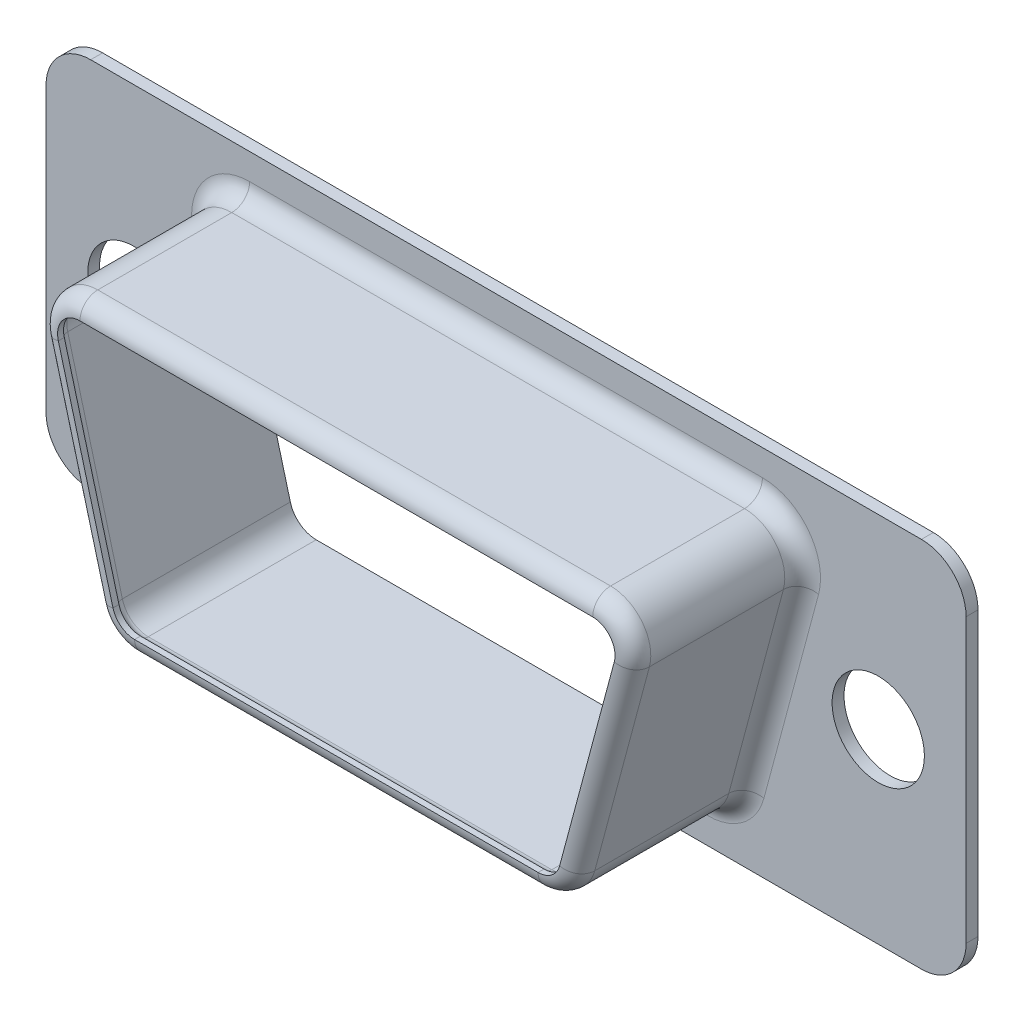
from build123d import *

# Parameters (mm, degrees)
SKETCH1_R           = 1.55
BOSS_EXTRUDE1_DEPTH = 0.4
BOSS_EXTRUDE2_DEPTH = 5.7
FILLET1_R           = 0.6
CUT_EXTRUDE1_DEPTH  = 5.9
FILLET2_R           = 0.3


# Some blends are built 0.0001 mm under size
with BuildPart() as part:
    # Sketch1 → Boss-Extrude1 (new body)
    with BuildSketch(Plane.XY):
        with BuildLine():
            Line((-13.95, 6.25), (13.95, 6.25))
            ThreePointArc((13.95, 6.25), (15.010660172, 5.810660172), (15.45, 4.75))
            Line((15.45, 4.75), (15.45, -4.75))
            ThreePointArc((15.45, -4.75), (15.010660172, -5.810660172), (13.95, -6.25))
            Line((13.95, -6.25), (-13.95, -6.25))
            ThreePointArc((-13.95, -6.25), (-15.010660172, -5.810660172), (-15.45, -4.75))
            Line((-15.45, -4.75), (-15.45, 4.75))
            ThreePointArc((-15.45, 4.75), (-15.010660172, 5.810660172), (-13.95, 6.25))
        make_face()
        with Locations((-12.5, 0)):
            Circle(SKETCH1_R, mode=Mode.SUBTRACT)
        with Locations((12.5, 0)):
            Circle(SKETCH1_R, mode=Mode.SUBTRACT)
        with BuildLine():
            Line((-8.611007598, 4.175), (8.611007598, 4.175))
            ThreePointArc((8.611007598, 4.175), (9.206022604, 3.881571072), (9.335451968, 3.230885716))
            Line((9.335451968, 3.230885716), (7.5, -3.619114284))
            ThreePointArc((7.5, -3.619114284), (7.232126702, -4.020015005), (6.77555563, -4.175))
            Line((6.77555563, -4.175), (-6.77555563, -4.175))
            ThreePointArc((-6.77555563, -4.175), (-7.232126702, -4.020015005), (-7.5, -3.619114284))
            Line((-7.5, -3.619114284), (-9.335451968, 3.230885716))
            ThreePointArc((-9.335451968, 3.230885716), (-9.206022604, 3.881571072), (-8.611007598, 4.175))
        make_face(mode=Mode.SUBTRACT)
    extrude(amount=BOSS_EXTRUDE1_DEPTH)

    # Sketch2 → Boss-Extrude2 (add)
    with BuildSketch(Plane.XY.offset(0.4)):
        with BuildLine():
            Line((-6.77555563, -4.775), (6.77555563, -4.775))
            ThreePointArc((6.77555563, -4.775), (7.597383559, -4.496027009), (8.079555496, -3.774405711))
            Line((8.079555496, -3.774405711), (9.915007464, 3.075594289))
            ThreePointArc((9.915007464, 3.075594289), (9.682034608, 4.246827929), (8.611007598, 4.775))
            Line((8.611007598, 4.775), (-8.611007598, 4.775))
            ThreePointArc((-8.611007598, 4.775), (-9.682034608, 4.246827929), (-9.915007464, 3.075594289))
            Line((-9.915007464, 3.075594289), (-8.079555496, -3.774405711))
            ThreePointArc((-8.079555496, -3.774405711), (-7.597383559, -4.496027009), (-6.77555563, -4.775))
        make_face()
        with BuildLine():
            Line((-6.77555563, -4.175), (6.77555563, -4.175))
            ThreePointArc((6.77555563, -4.175), (7.232126702, -4.020015005), (7.5, -3.619114284))
            Line((7.5, -3.619114284), (9.335451968, 3.230885716))
            ThreePointArc((9.335451968, 3.230885716), (9.206022604, 3.881571072), (8.611007598, 4.175))
            Line((8.611007598, 4.175), (-8.611007598, 4.175))
            ThreePointArc((-8.611007598, 4.175), (-9.206022604, 3.881571072), (-9.335451968, 3.230885716))
            Line((-9.335451968, 3.230885716), (-7.5, -3.619114284))
            ThreePointArc((-7.5, -3.619114284), (-7.232126702, -4.020015005), (-6.77555563, -4.175))
        make_face(mode=Mode.SUBTRACT)
    extrude(amount=BOSS_EXTRUDE2_DEPTH)

    # Fillet1
    fillet1_edges = [part.edges().sort_by_distance(p)[0] for p in [
        (-7.597383559, -4.496027009, 6.1),
        (0, -4.775, 6.1),
        (7.597383559, -4.496027009, 6.1),
        (8.99728148, -0.349405711, 6.1),
        (9.682034608, 4.246827929, 6.1),
        (0, 4.775, 6.1),
        (-9.682034608, 4.246827929, 6.1),
        (-8.99728148, -0.349405711, 6.1),
        (-7.597383559, -4.496027009, 0.4),
        (0, -4.775, 0.4),
        (7.597383559, -4.496027009, 0.4),
        (8.99728148, -0.349405711, 0.4),
        (9.682034608, 4.246827929, 0.4),
        (0, 4.775, 0.4),
        (-9.682034608, 4.246827929, 0.4),
        (-8.99728148, -0.349405711, 0.4),
    ]]
    fillet(fillet1_edges, radius=FILLET1_R - 0.0001)  # a hair under: the kernel refuses the full size

    # Sketch3 → Cut-Extrude1 (cut)
    with BuildSketch(Plane(origin=(0, 0, 0), x_dir=(-1, 0, 0), z_dir=(0, 0, -1))):
        with BuildLine():
            Line((-6.77555563, -4.325), (6.77555563, -4.325))
            ThreePointArc((6.77555563, -4.325), (7.323440916, -4.139018006), (7.644888874, -3.657937141))
            Line((7.644888874, -3.657937141), (9.480340842, 3.192062859))
            ThreePointArc((9.480340842, 3.192062859), (9.325025605, 3.972885286), (8.611007598, 4.325))
            Line((8.611007598, 4.325), (-8.611007598, 4.325))
            ThreePointArc((-8.611007598, 4.325), (-9.325025605, 3.972885286), (-9.480340842, 3.192062859))
            Line((-9.480340842, 3.192062859), (-7.644888874, -3.657937141))
            ThreePointArc((-7.644888874, -3.657937141), (-7.323440916, -4.139018006), (-6.77555563, -4.325))
        make_face()
    extrude(amount=-CUT_EXTRUDE1_DEPTH, mode=Mode.SUBTRACT)

    # Fillet2
    # the kernel refuses this fillet: 0.3 mm, written as the material it adds along each edge
    with BuildSketch(Plane(origin=(6.77555563, -3.425, 5.9), x_dir=(0.9659258262890676, -0.2588190451025228, 0), z_dir=(0.2588190451025228, 0.9659258262890676, 0))) as fillet2_piece_1:
        with BuildLine():
            CenterArc((0.6, 0.259807621), FILLET2_R, 300, 60)
            Line((0.75, 0), (0.753, -0.005196152))
            ThreePointArc((0.753, -0.005196152), (0.825, -0.006), (0.9, -0.006))
            Line((0.9, -0.006), (0.906, 0))
            Line((0.906, 0), (0.906, 0.259807621))
            Line((0.906, 0.259807621), (0.9, 0.259807621))
        make_face()
    revolve(axis=Axis((6.77555563, -3.425, 5.9), (0, 0, -1)), revolution_arc=75)
    with BuildSketch(Plane(origin=(9.480340842, 3.192062859, 5.9), x_dir=(0, 0, -1), z_dir=(-0.25881904510252507, -0.9659258262890672, 0)), Plane(origin=(-7.644888874, -3.657937141, 5.9), x_dir=(0, 0, -1), z_dir=(-0.25881904510252135, 0.9659258262890682, 0))) as fillet2_piece_2:
        with BuildLine():
            CenterArc((0.259807621, -0.3), FILLET2_R, 90, 60)
            Line((0, -0.15), (-0.005196152, -0.147))
            ThreePointArc((-0.005196152, -0.147), (-0.006, -0.075), (-0.006, 0))
            Line((-0.006, 0), (0, 0.006))
            Line((0, 0.006), (0.259807621, 0.006))
            Line((0.259807621, 0.006), (0.259807621, 0))
        make_face()
    extrude(amount=7.091641836)
    with BuildSketch(Plane(origin=(8.611007598, 3.425, 5.9), x_dir=(0, 1, 0), z_dir=(-1, 0, 0))) as fillet2_piece_3:
        with BuildLine():
            CenterArc((0.6, 0.259807621), FILLET2_R, 300, 60)
            Line((0.75, 0), (0.753, -0.005196152))
            ThreePointArc((0.753, -0.005196152), (0.825, -0.006), (0.9, -0.006))
            Line((0.9, -0.006), (0.906, 0))
            Line((0.906, 0), (0.906, 0.259807621))
            Line((0.906, 0.259807621), (0.9, 0.259807621))
        make_face()
    revolve(axis=Axis((8.611007598, 3.425, 5.9), (0, 0, -1)), revolution_arc=105)
    with BuildSketch(Plane(origin=(-8.611007598, 4.325, 5.9), x_dir=(0, 0, -1), z_dir=(1, 0, 0))) as fillet2_piece_4:
        with BuildLine():
            CenterArc((0.259807621, -0.3), FILLET2_R, 90, 60)
            Line((0, -0.15), (-0.005196152, -0.147))
            ThreePointArc((-0.005196152, -0.147), (-0.006, -0.075), (-0.006, 0))
            Line((-0.006, 0), (0, 0.006))
            Line((0, 0.006), (0.259807621, 0.006))
            Line((0.259807621, 0.006), (0.259807621, 0))
        make_face()
    extrude(amount=17.222015197)
    with BuildSketch(Plane(origin=(-8.611007598, 3.425, 5.9), x_dir=(-0.9659258262890688, -0.25881904510251935, 0), z_dir=(0.25881904510251935, -0.9659258262890688, 0))) as fillet2_piece_5:
        with BuildLine():
            CenterArc((0.6, 0.259807621), FILLET2_R, 300, 60)
            Line((0.75, 0), (0.753, -0.005196152))
            ThreePointArc((0.753, -0.005196152), (0.825, -0.006), (0.9, -0.006))
            Line((0.9, -0.006), (0.906, 0))
            Line((0.906, 0), (0.906, 0.259807621))
            Line((0.906, 0.259807621), (0.9, 0.259807621))
        make_face()
    revolve(axis=Axis((-8.611007598, 3.425, 5.9), (0, 0, -1)), revolution_arc=105)
    with BuildSketch(Plane(origin=(-6.77555563, -3.425, 5.9), x_dir=(0, -1, 0), z_dir=(1, 0, 0))) as fillet2_piece_6:
        with BuildLine():
            CenterArc((0.6, 0.259807621), FILLET2_R, 300, 60)
            Line((0.75, 0), (0.753, -0.005196152))
            ThreePointArc((0.753, -0.005196152), (0.825, -0.006), (0.9, -0.006))
            Line((0.9, -0.006), (0.906, 0))
            Line((0.906, 0), (0.906, 0.259807621))
            Line((0.906, 0.259807621), (0.9, 0.259807621))
        make_face()
    revolve(axis=Axis((-6.77555563, -3.425, 5.9), (0, 0, -1)), revolution_arc=75)
    with BuildSketch(Plane(origin=(6.77555563, -4.325, 5.9), x_dir=(0, 0, -1), z_dir=(-1, 0, 0))) as fillet2_piece_7:
        with BuildLine():
            CenterArc((0.259807621, -0.3), FILLET2_R, 90, 60)
            Line((0, -0.15), (-0.005196152, -0.147))
            ThreePointArc((-0.005196152, -0.147), (-0.006, -0.075), (-0.006, 0))
            Line((-0.006, 0), (0, 0.006))
            Line((0, 0.006), (0.259807621, 0.006))
            Line((0.259807621, 0.006), (0.259807621, 0))
        make_face()
    extrude(amount=13.551111261)


solid = part.part
